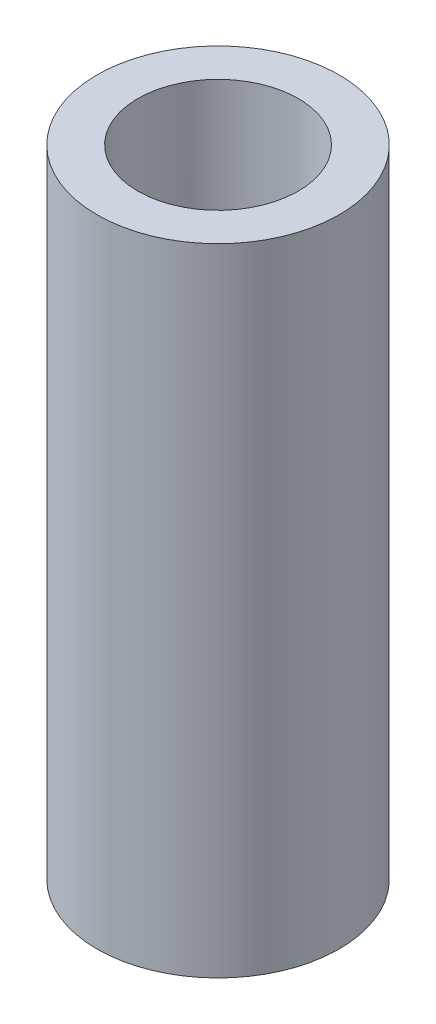
from build123d import *

# Parameters (mm, degrees)
SKETCH1_R           = 4
BOSS_EXTRUDE1_DEPTH = 21
SKETCH2_R           = 3.2
CUT_EXTRUDE1_DEPTH  = 10
SKETCH3_R           = 2.65
CUT_EXTRUDE3_DEPTH  = 10


with BuildPart() as part:
    # Sketch1 → Boss-Extrude1 (new body)
    with BuildSketch(Plane(origin=(0, 0, 0), x_dir=(1, 0, 0), z_dir=(0, 1, 0))):
        with Locations(Location((0, 0, 0), (0, 0, 90))):
            Circle(SKETCH1_R)
    extrude(amount=BOSS_EXTRUDE1_DEPTH)

    # Sketch2 → Cut-Extrude1 (cut)
    with BuildSketch(Plane.XZ):
        with Locations(Location((0, 0, 0), (0, 0, 270))):
            Circle(SKETCH2_R)
    extrude(amount=-CUT_EXTRUDE1_DEPTH, mode=Mode.SUBTRACT)

    # Sketch3 → Cut-Extrude3 (cut)
    with BuildSketch(Plane(origin=(0, 21, 0), x_dir=(1, 0, 0), z_dir=(0, 1, 0))):
        with Locations(Location((0, 0, 0), (0, 0, 270))):
            Circle(SKETCH3_R)
    extrude(amount=-CUT_EXTRUDE3_DEPTH, mode=Mode.SUBTRACT)

    # Cut-Extrude5: read off the stored shape, not the designer's step
    # Cut-Extrude5: loft between two sections, ruled curve by curve
    cut_extrude5_from = [
        Edge.make_three_point_arc((-2.24981464, 14.6, 0), (-2.24981464, 16, 1.4), (-2.24981464, 17.4, 0)),
        Edge.make_three_point_arc((-2.24981464, 17.4, 0), (-2.24981464, 16, -1.4), (-2.24981464, 14.6, 0)),
    ]
    cut_extrude5_to = [
        Edge.make_three_point_arc((-3.999916451, 14.6, 0), (-3.999916451, 16, 1.4), (-3.999916451, 17.4, 0)),
        Edge.make_three_point_arc((-3.999916451, 17.4, 0), (-3.999916451, 16, -1.4), (-3.999916451, 14.6, 0)),
    ]
    cut_extrude5 = Solid(Shell([*[Face.make_surface_from_curves(cut_extrude5_from[k], cut_extrude5_to[k]) for k in range(2)], Face(Wire(cut_extrude5_from)), Face(Wire(cut_extrude5_to))]))
    add(cut_extrude5, mode=Mode.SUBTRACT)

    # Cut-Extrude5 2: loft between two sections, ruled curve by curve
    cut_extrude5_2_from = [
        Edge.make_three_point_arc((-2.877351837, 3.6, 0), (-2.877351837, 5, 1.4), (-2.877351837, 6.4, 0)),
        Edge.make_three_point_arc((-2.877351837, 6.4, 0), (-2.877351837, 5, -1.4), (-2.877351837, 3.6, 0)),
    ]
    cut_extrude5_2_to = [
        Edge.make_three_point_arc((-3.999916451, 3.6, 0), (-3.999916451, 5, 1.4), (-3.999916451, 6.4, 0)),
        Edge.make_three_point_arc((-3.999916451, 6.4, 0), (-3.999916451, 5, -1.4), (-3.999916451, 3.6, 0)),
    ]
    cut_extrude5_2 = Solid(Shell([*[Face.make_surface_from_curves(cut_extrude5_2_from[k], cut_extrude5_2_to[k]) for k in range(2)], Face(Wire(cut_extrude5_2_from)), Face(Wire(cut_extrude5_2_to))]))
    add(cut_extrude5_2, mode=Mode.SUBTRACT)


solid = part.part
